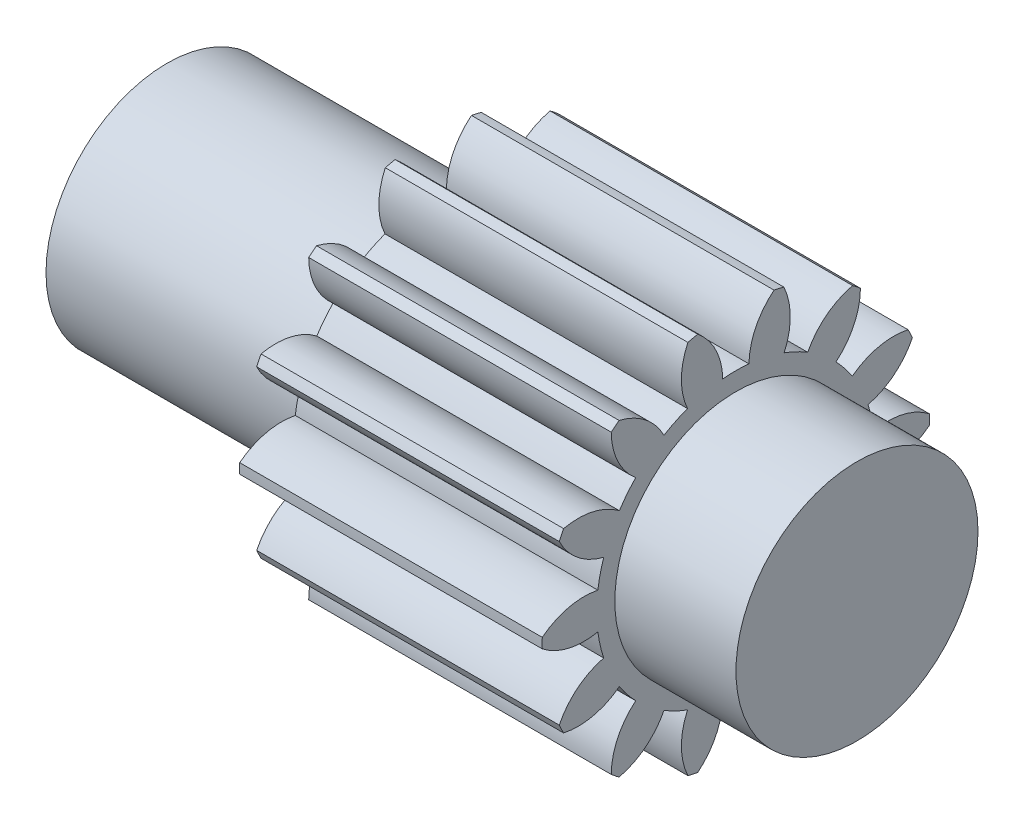
from build123d import *

# Parameters (mm, degrees)
SPUR_START                 = -25.541998066
SPUR_GEAR_AM_OUTLINE_R     = 1.5
SPUR_GEAR_AM_DEPTH         = 14
SPUR_START_2               = -36.542048866
SPUR_GEAR_AM_2_OUTLINE_R   = 5
SPUR_GEAR_AM_2_OUTLINE_R_2 = 1.5
SPUR_GEAR_AM_2_DEPTH       = 11.0000508
SKETCH1_R                  = 10.392655515
CUT_EXTRUDE1_DEPTH         = 1.500223942
SKETCH2_R                  = 5
BOSS_EXTRUDE1_DEPTH        = 5.004484533
SKETCH3_R                  = 1.5
CUT_EXTRUDE2_DEPTH         = 10


# Read off the part's stored shape, not the designer's step: spur gear_am
with BuildPart() as part:
    # spur gear_am outline → spur gear_am (new body)
    with BuildSketch(Plane.YZ.offset(SPUR_START)):
        with BuildLine():
            ThreePointArc((8.934177524, 12.472931761), (8.746459365, 12.38550613), (8.561066896, 12.293251153))
            ThreePointArc((8.561066896, 12.293251153), (8.561742052, 11.085003925), (9.071453323, 9.989533141))
            ThreePointArc((9.071453323, 9.989533141), (8.633086407, 9.672504379), (8.226460402, 9.315673773))
            ThreePointArc((8.226460402, 9.315673773), (7.271876786, 10.0563707), (6.094073075, 10.325889231))
            ThreePointArc((6.094073075, 10.325889231), (5.962877418, 10.165673601), (5.835872509, 10.002115962))
            ThreePointArc((5.835872509, 10.002115962), (6.360719629, 8.913815765), (7.295260575, 8.147986124))
            ThreePointArc((7.295260575, 8.147986124), (7.037859256, 7.672152803), (6.826324883, 7.174231124))
            ThreePointArc((6.826324883, 7.174231124), (5.64489841, 7.427397687), (4.466794227, 7.159195615))
            ThreePointArc((4.466794227, 7.159195615), (4.41810598, 6.957922658), (4.374643512, 6.755456952))
            ThreePointArc((4.374643512, 6.755456952), (5.319710186, 6.002654986), (6.493983512, 5.718148442))
            ThreePointArc((6.493983512, 5.718148442), (6.468529278, 5.177755187), (6.493983512, 4.637361931))
            ThreePointArc((6.493983512, 4.637361931), (5.319710186, 4.352855387), (4.374643512, 3.600053421))
            ThreePointArc((4.374643512, 3.600053421), (4.41810598, 3.397587715), (4.466794227, 3.196314758))
            ThreePointArc((4.466794227, 3.196314758), (5.64489841, 2.928112685), (6.826324883, 3.181279248))
            ThreePointArc((6.826324883, 3.181279248), (7.037859256, 2.68335757), (7.295260575, 2.207524249))
            ThreePointArc((7.295260575, 2.207524249), (6.360719629, 1.441694608), (5.835872509, 0.353394411))
            ThreePointArc((5.835872509, 0.353394411), (5.962877418, 0.189836772), (6.094073075, 0.029621142))
            ThreePointArc((6.094073075, 0.029621142), (7.271876786, 0.299139672), (8.226460402, 1.039836599))
            ThreePointArc((8.226460402, 1.039836599), (8.633086407, 0.683005994), (9.071453323, 0.365977232))
            ThreePointArc((9.071453323, 0.365977232), (8.561742052, -0.729493552), (8.561066896, -1.93774078))
            ThreePointArc((8.561066896, -1.93774078), (8.746459365, -2.029995757), (8.934177524, -2.117421389))
            ThreePointArc((8.934177524, -2.117421389), (9.878402292, -1.363563706), (10.41707606, -0.282040525))
            ThreePointArc((10.41707606, -0.282040525), (10.938256428, -0.427105381), (11.470764997, -0.522538149))
            ThreePointArc((11.470764997, -0.522538149), (11.48683797, -1.730678653), (12.0104685, -2.819564729))
            ThreePointArc((12.0104685, -2.819564729), (12.217529278, -2.822244814), (12.424590055, -2.819564729))
            ThreePointArc((12.424590055, -2.819564729), (12.948220585, -1.730678653), (12.964293559, -0.522538149))
            ThreePointArc((12.964293559, -0.522538149), (13.496802127, -0.427105381), (14.017982495, -0.282040525))
            ThreePointArc((14.017982495, -0.282040525), (14.556656263, -1.363563706), (15.500881031, -2.117421389))
            ThreePointArc((15.500881031, -2.117421389), (15.688599191, -2.029995757), (15.87399166, -1.93774078))
            ThreePointArc((15.87399166, -1.93774078), (15.873316504, -0.729493552), (15.363605233, 0.365977232))
            ThreePointArc((15.363605233, 0.365977232), (15.801972149, 0.683005994), (16.208598153, 1.039836599))
            ThreePointArc((16.208598153, 1.039836599), (17.16318177, 0.299139672), (18.34098548, 0.029621142))
            ThreePointArc((18.34098548, 0.029621142), (18.472181137, 0.189836772), (18.599186046, 0.353394411))
            ThreePointArc((18.599186046, 0.353394411), (18.074338927, 1.441694609), (17.13979798, 2.207524249))
            ThreePointArc((17.13979798, 2.207524249), (17.397199299, 2.68335757), (17.608733673, 3.181279248))
            ThreePointArc((17.608733673, 3.181279248), (18.790160146, 2.928112685), (19.968264329, 3.196314758))
            ThreePointArc((19.968264329, 3.196314758), (20.016952575, 3.397587715), (20.060415044, 3.600053421))
            ThreePointArc((20.060415044, 3.600053421), (19.11534837, 4.352855387), (17.941075043, 4.637361931))
            ThreePointArc((17.941075043, 4.637361931), (17.966529278, 5.177755187), (17.941075043, 5.718148442))
            ThreePointArc((17.941075043, 5.718148442), (19.11534837, 6.002654986), (20.060415044, 6.755456952))
            ThreePointArc((20.060415044, 6.755456952), (20.016952575, 6.957922658), (19.968264329, 7.159195615))
            ThreePointArc((19.968264329, 7.159195615), (18.790160146, 7.427397687), (17.608733673, 7.174231124))
            ThreePointArc((17.608733673, 7.174231124), (17.397199299, 7.672152802), (17.13979798, 8.147986124))
            ThreePointArc((17.13979798, 8.147986124), (18.074338927, 8.913815764), (18.599186046, 10.002115962))
            ThreePointArc((18.599186046, 10.002115962), (18.472181137, 10.165673601), (18.34098548, 10.325889231))
            ThreePointArc((18.34098548, 10.325889231), (17.16318177, 10.0563707), (16.208598153, 9.315673773))
            ThreePointArc((16.208598153, 9.315673773), (15.801972149, 9.672504379), (15.363605233, 9.989533141))
            ThreePointArc((15.363605233, 9.989533141), (15.873316504, 11.085003925), (15.87399166, 12.293251153))
            ThreePointArc((15.87399166, 12.293251153), (15.688599191, 12.38550613), (15.500881031, 12.472931761))
            ThreePointArc((15.500881031, 12.472931761), (14.556656263, 11.719074079), (14.017982495, 10.637550898))
            ThreePointArc((14.017982495, 10.637550898), (13.496802127, 10.782615754), (12.964293559, 10.878048522))
            ThreePointArc((12.964293559, 10.878048522), (12.948220585, 12.086189026), (12.424590055, 13.175075102))
            ThreePointArc((12.424590055, 13.175075102), (12.217529278, 13.177755186), (12.0104685, 13.175075102))
            ThreePointArc((12.0104685, 13.175075102), (11.48683797, 12.086189026), (11.470764997, 10.878048522))
            ThreePointArc((11.470764997, 10.878048522), (10.938256428, 10.782615754), (10.41707606, 10.637550898))
            ThreePointArc((10.41707606, 10.637550898), (9.878402292, 11.719074079), (8.934177524, 12.472931761))
        make_face()
        with Locations((12.217529278, 5.177755186)):
            Circle(SPUR_GEAR_AM_OUTLINE_R, mode=Mode.SUBTRACT)
    extrude(amount=SPUR_GEAR_AM_DEPTH)

    # spur gear_am 2 outline → spur gear_am 2 (add)
    with BuildSketch(Plane.YZ.offset(SPUR_START_2)):
        with Locations((12.217529278, 5.177755186)):
            Circle(SPUR_GEAR_AM_2_OUTLINE_R)
        with Locations((12.217529278, 5.177755186)):
            Circle(SPUR_GEAR_AM_2_OUTLINE_R_2, mode=Mode.SUBTRACT)
    extrude(amount=SPUR_GEAR_AM_2_DEPTH)

    # Sketch1 → Cut-Extrude1 (cut)
    with BuildSketch(Plane(origin=(-11.541998066, 0, 0), x_dir=(0, 0, -1), z_dir=(1, 0, 0))):
        with Locations((-5.177755186, 12.217529278)):
            Circle(SKETCH1_R)
    extrude(amount=-CUT_EXTRUDE1_DEPTH, mode=Mode.SUBTRACT)

    # Sketch2 → Boss-Extrude1 (add)
    with BuildSketch(Plane(origin=(-13.042222007, 0, 0), x_dir=(0, 0, -1), z_dir=(1, 0, 0))):
        with Locations((-5.177755186, 12.217529278)):
            Circle(SKETCH2_R)
    extrude(amount=BOSS_EXTRUDE1_DEPTH)

    # Sketch3 → Cut-Extrude2 (cut)
    with BuildSketch(Plane.ZY.offset(36.542048866)):
        with BuildLine():
            Line((7.682755186, 13.957493358), (2.672755186, 13.957493358))
            ThreePointArc((2.672755186, 13.957493358), (4.266094614, 9.306966617), (8.227755186, 12.217529278))
            ThreePointArc((8.227755186, 12.217529278), (8.088317847, 13.12918985), (7.682755186, 13.957493358))
        make_face()
        with Locations((5.177755186, 12.217529278)):
            Circle(SKETCH3_R, mode=Mode.SUBTRACT)
    extrude(amount=-CUT_EXTRUDE2_DEPTH, mode=Mode.SUBTRACT)


solid = part.part
